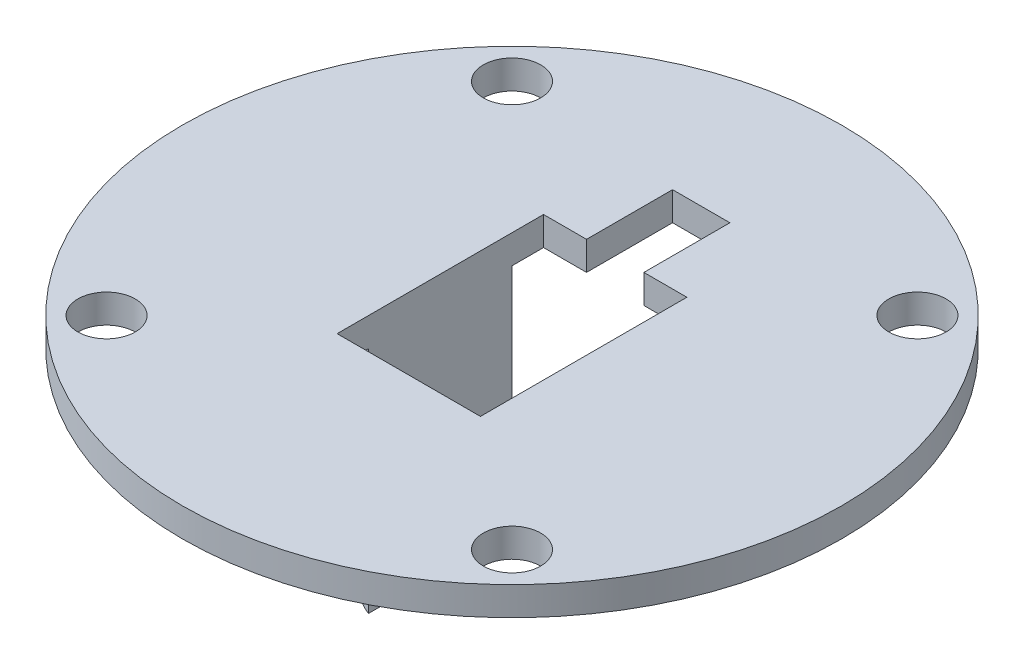
from build123d import *

# Parameters (mm, degrees)
SKETCH2_R           = 57.5
BOSS_EXTRUDE1_DEPTH = 5
SKETCH3_R           = 5
CUT_EXTRUDE1_DEPTH  = 82.470853684
SKETCH4_W           = 25
SKETCH4_H           = 36
CUT_EXTRUDE2_DEPTH  = 82.470853684
SKETCH5_W           = 5
SKETCH5_H           = 25
BOSS_EXTRUDE2_DEPTH = 40
FILLET1_R           = 6
SKETCH7_W           = 10
SKETCH7_H           = 15
CUT_EXTRUDE3_DEPTH  = 93.938151477


with BuildPart() as part:
    # Sketch2 → Boss-Extrude1 (new body)
    with BuildSketch(Plane(origin=(0, 0, 0), x_dir=(1, 0, 0), z_dir=(0, 1, 0))):
        with Locations(Location((0, 0, 0), (0, 0, 270))):
            Circle(SKETCH2_R)
    extrude(amount=BOSS_EXTRUDE1_DEPTH)

    # Sketch3 → Cut-Extrude1 (cut, through all)
    with BuildSketch(Plane(origin=(0, 5, 0), x_dir=(1, 0, 0), z_dir=(0, 1, 0))):
        with Locations(Location((-35.355339059, 35.355339059, 0), (0, 0, 270))):
            Circle(SKETCH3_R)
        with Locations(Location((35.355339059, 35.355339059, 0), (0, 0, 270))):
            Circle(SKETCH3_R)
        with Locations(Location((35.355339059, -35.355339059, 0), (0, 0, 270))):
            Circle(SKETCH3_R)
        with Locations(Location((-35.355339059, -35.355339059, 0), (0, 0, 270))):
            Circle(SKETCH3_R)
    extrude(amount=-CUT_EXTRUDE1_DEPTH, mode=Mode.SUBTRACT)

    # Sketch4 → Cut-Extrude2 (cut, through all)
    with BuildSketch(Plane(origin=(0, 5, 0), x_dir=(1, 0, 0), z_dir=(0, 1, 0))):
        Rectangle(SKETCH4_W, SKETCH4_H)
    extrude(amount=-CUT_EXTRUDE2_DEPTH, mode=Mode.SUBTRACT)

    # Sketch5 → Boss-Extrude2 (add)
    with BuildSketch(Plane.XZ):
        with Locations((-15, 0)):
            Rectangle(SKETCH5_W, SKETCH5_H)
    extrude(amount=BOSS_EXTRUDE2_DEPTH)

    # Fillet1
    # the kernel refuses this fillet: 6 mm, written as the material it takes off along each edge
    with BuildSketch(Plane(origin=(-17.5, -40, 27.290199458), x_dir=(0, 1, 0), z_dir=(0, 0, -1))) as fillet1_piece_1:
        with BuildLine():
            CenterArc((5.916079783, 6), FILLET1_R, 189.594068227, 80.405931773)
            Line((0, 5), (0, 0))
            Line((0, 0), (5.916079783, 0))
        make_face()
    extrude(amount=54.580398916, mode=Mode.SUBTRACT)
    with BuildSketch(Plane(origin=(-17.5, 0, -12.5), x_dir=(1, 0, 0), z_dir=(0, -1, 0))) as fillet1_piece_2:
        with BuildLine():
            CenterArc((6, 5.916079783), FILLET1_R, 180, 80.405931773)
            Line((0, 5.916079783), (0, 0))
            Line((0, 0), (5, 0))
        make_face()
    extrude(amount=54.790199458, mode=Mode.SUBTRACT)
    with BuildSketch(Plane(origin=(-17.5, 0, 12.5), x_dir=(0, 0, -1), z_dir=(0, -1, 0))) as fillet1_piece_3:
        with BuildLine():
            CenterArc((5.916079783, 6), FILLET1_R, 189.594068227, 80.405931773)
            Line((0, 5), (0, 0))
            Line((0, 0), (5.916079783, 0))
        make_face()
    extrude(amount=54.790199458, mode=Mode.SUBTRACT)

    # Sketch7 → Cut-Extrude3 (cut, through all)
    with BuildSketch(Plane(origin=(0, 5, 0), x_dir=(1, 0, 0), z_dir=(0, 1, 0))):
        with Locations((0, 25.5)):
            Rectangle(SKETCH7_W, SKETCH7_H)
    extrude(amount=-CUT_EXTRUDE3_DEPTH, mode=Mode.SUBTRACT)


solid = part.part
